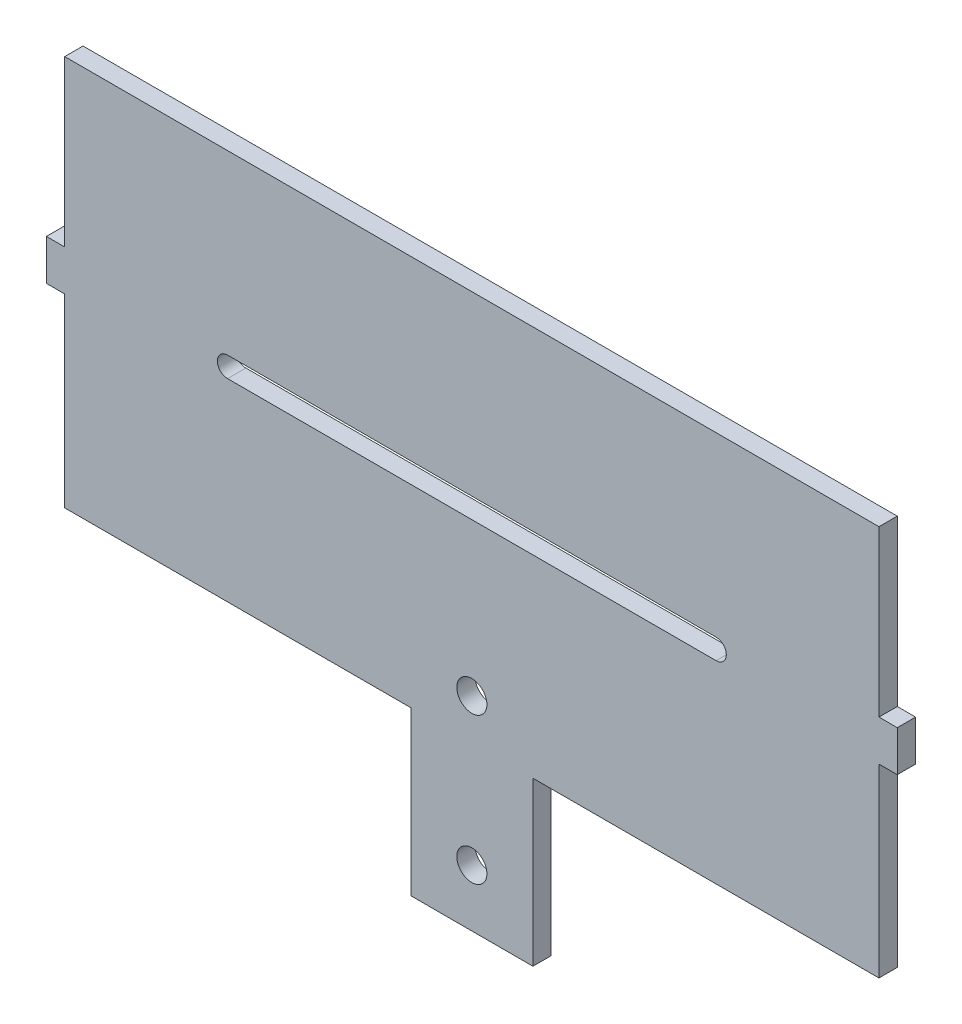
from build123d import *

# Parameters (mm, degrees)
BOSS_EXTRUDE1_DEPTH     = 5.715
CUT_EXTRUDE1_DEPTH      = 176.243894188
CUT_EXTRUDE2_DEPTH      = 176.243894188
CUT_EXTRUDE2_DEPTH_BACK = 176.243894188
SKETCH4_R               = 4.699
SKETCH5_W               = 254
SKETCH5_H               = 5.08
CUT_EXTRUDE3_DEPTH      = 176.243894188
SKETCH6_R               = 4.699
CUT_EXTRUDE4_DEPTH      = 176.243894188


with BuildPart() as part:
    # Sketch1 → Boss-Extrude1 (new body)
    with BuildSketch(Plane.XY):
        Polygon((19.05, -63.5), (127, -63.5), (127, -5.715), (132.715, -5.715), (132.715, 6.985), (127, 6.985), (127, 63.5), (-127, 63.5), (-127, 6.985), (-132.715, 6.985), (-132.715, -5.715), (-127, -5.715), (-127, -63.5), (-19.05, -63.5), (-19.05, -114.3), (19.05, -114.3), align=None)
    extrude(amount=BOSS_EXTRUDE1_DEPTH)

    # Sketch2 → Cut-Extrude1 (cut, through all)
    with BuildSketch(Plane.XY.offset(5.715)):
        with BuildLine():
            Line((76.2, -3.175), (-76.2, -3.175))
            ThreePointArc((-76.2, -3.175), (-79.375, 0), (-76.2, 3.175))
            Line((-76.2, 3.175), (76.2, 3.175))
            ThreePointArc((76.2, 3.175), (79.375, 0), (76.2, -3.175))
        make_face()
    extrude(amount=-CUT_EXTRUDE1_DEPTH, mode=Mode.SUBTRACT)

    # Sketch4 → Cut-Extrude2 (cut, two sides: drawn at the far end of the back side and taken through both)
    with BuildSketch(Plane.XY.offset(5.715).offset(-CUT_EXTRUDE2_DEPTH_BACK)):
        with Locations((0, -50.8)):
            Circle(SKETCH4_R)
    extrude(amount=CUT_EXTRUDE2_DEPTH + CUT_EXTRUDE2_DEPTH_BACK, mode=Mode.SUBTRACT)

    # Sketch5 → Cut-Extrude3 (cut, through all)
    with BuildSketch(Plane.XY.offset(5.715)):
        with Locations((0, 60.96)):
            Rectangle(SKETCH5_W, SKETCH5_H)
    extrude(amount=-CUT_EXTRUDE3_DEPTH, mode=Mode.SUBTRACT)

    # Sketch6 → Cut-Extrude4 (cut, through all)
    with BuildSketch(Plane.XY.offset(5.715)):
        with Locations((0, -96.52)):
            Circle(SKETCH6_R)
    extrude(amount=-CUT_EXTRUDE4_DEPTH, mode=Mode.SUBTRACT)


solid = part.part
